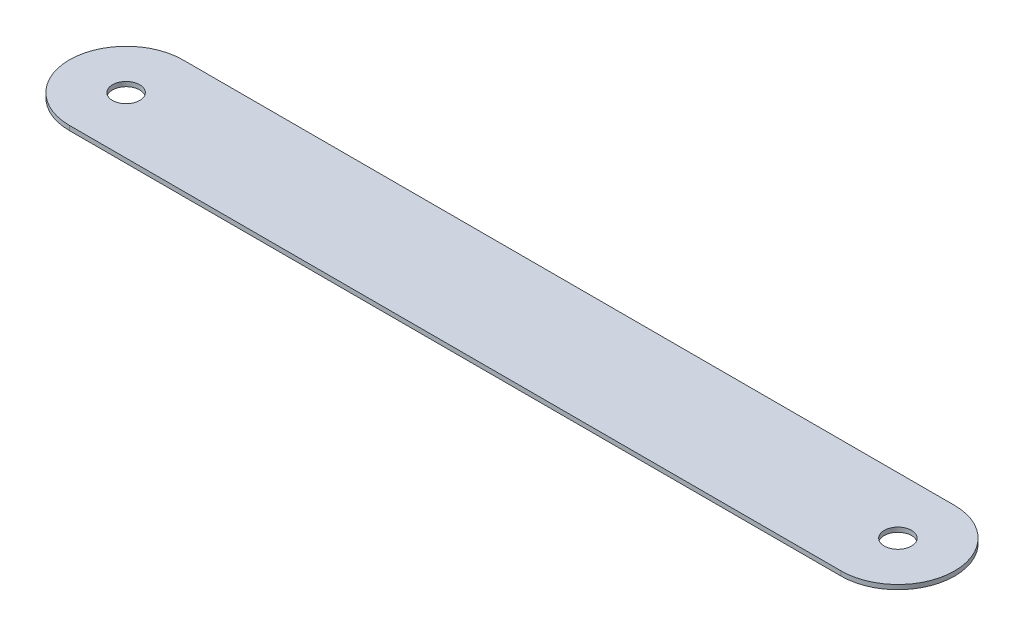
from build123d import *

# Parameters (mm, degrees)
SKETCH_1_R      = 1.5
EXTRUDE_1_DEPTH = 0.5


with BuildPart() as part:
    # 草圖1 → 填料-伸長1 (new body)
    with BuildSketch(Plane(origin=(0, 0, 0), x_dir=(1, 0, 0), z_dir=(0, 1, 0))):
        with BuildLine():
            Line((-42.5, 6.25), (42.5, 6.25))
            ThreePointArc((42.5, 6.25), (48.75, 0), (42.5, -6.25))
            Line((42.5, -6.25), (-42.5, -6.25))
            ThreePointArc((-42.5, -6.25), (-48.75, 0), (-42.5, 6.25))
        make_face()
        with Locations((-42.5, 0)):
            Circle(SKETCH_1_R, mode=Mode.SUBTRACT)
        with Locations((42.5, 0)):
            Circle(SKETCH_1_R, mode=Mode.SUBTRACT)
    extrude(amount=EXTRUDE_1_DEPTH)


solid = part.part
